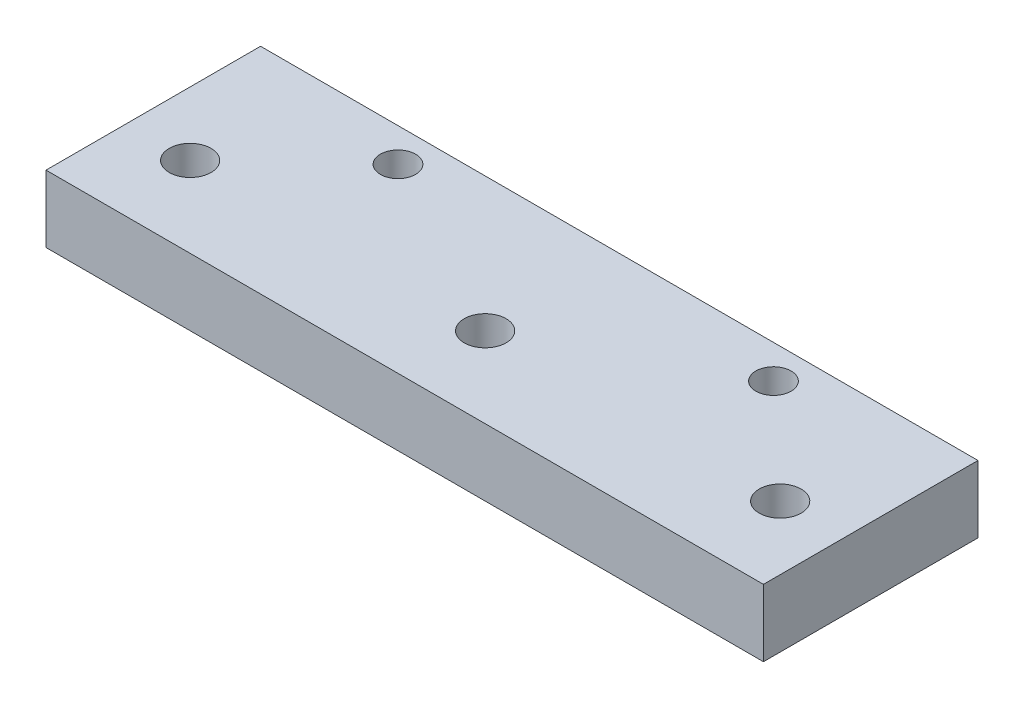
from build123d import *

# Parameters (mm, degrees)
SKETCH1_W           = 339.725
SKETCH1_H           = 101.6
BOSS_EXTRUDE1_DEPTH = 15.875
CUT_EXTRUDE2_START  = -15.875
SKETCH2_R           = 9.9187
CUT_EXTRUDE2_DEPTH  = 63.5
CUT_EXTRUDE4_START  = -15.875
SKETCH3_R           = 15.0876
CUT_EXTRUDE4_DEPTH  = 3.175
CUT_EXTRUDE6_START  = -15.875
SKETCH4_R           = 8.3312
CUT_EXTRUDE6_DEPTH  = 63.5


with BuildPart() as part:
    # Sketch1 → Boss-Extrude1 (new, symmetric)
    with BuildSketch(Plane(origin=(0, 0, 0), x_dir=(1, 0, 0), z_dir=(0, 1, 0))):
        Rectangle(SKETCH1_W, SKETCH1_H)
    extrude(amount=BOSS_EXTRUDE1_DEPTH, both=True)

    # Sketch2 → Cut-Extrude2 (cut)
    with BuildSketch(Plane(origin=(0, 0, 0), x_dir=(1, 0, 0), z_dir=(0, 1, 0)).offset(CUT_EXTRUDE2_START)):
        with Locations((-139.7127, -12.7)):
            Circle(SKETCH2_R)
        with Locations((-0.0127, -12.7)):
            Circle(SKETCH2_R)
        with Locations((139.6873, -12.7)):
            Circle(SKETCH2_R)
    extrude(amount=CUT_EXTRUDE2_DEPTH, mode=Mode.SUBTRACT)

    # Sketch3 → Cut-Extrude4 (cut)
    with BuildSketch(Plane(origin=(0, 0, 0), x_dir=(1, 0, 0), z_dir=(0, 1, 0)).offset(CUT_EXTRUDE4_START)):
        with Locations((-139.7127, -12.7)):
            Circle(SKETCH3_R)
        with Locations((-0.0127, -12.7)):
            Circle(SKETCH3_R)
        with Locations((139.6873, -12.7)):
            Circle(SKETCH3_R)
    extrude(amount=CUT_EXTRUDE4_DEPTH, mode=Mode.SUBTRACT)

    # Sketch4 → Cut-Extrude6 (cut)
    with BuildSketch(Plane(origin=(0, 0, 0), x_dir=(1, 0, 0), z_dir=(0, 1, 0)).offset(CUT_EXTRUDE6_START)):
        with Locations((-88.9127, 34.925)):
            Circle(SKETCH4_R)
        with Locations((88.8873, 34.925)):
            Circle(SKETCH4_R)
    extrude(amount=CUT_EXTRUDE6_DEPTH, mode=Mode.SUBTRACT)


solid = part.part
